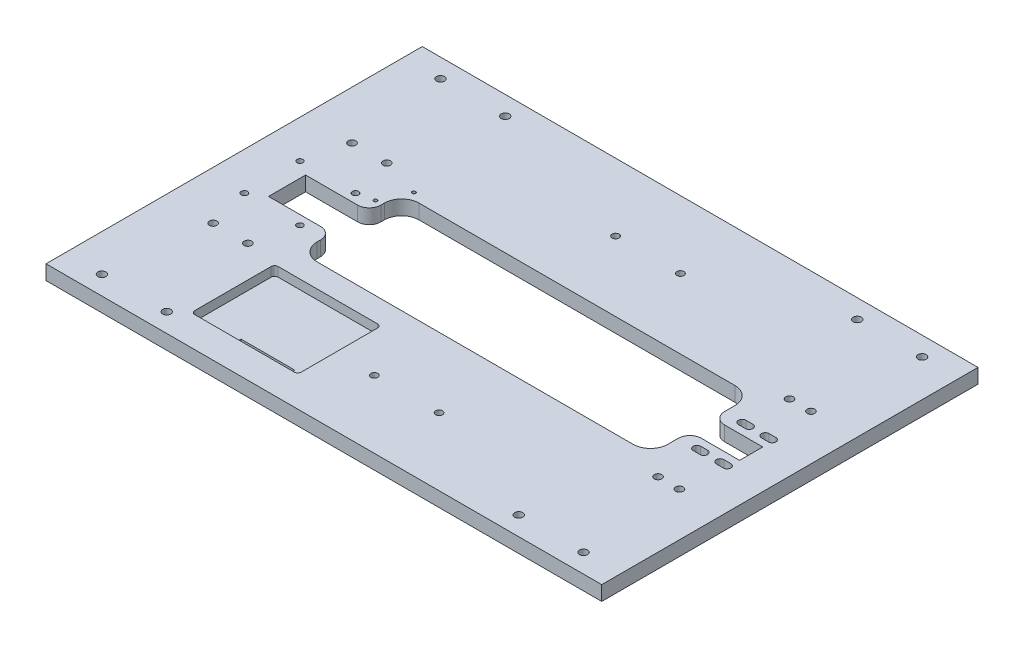
from build123d import *

# Parameters (mm, degrees)
SKETCH1_W                      = 480
SKETCH1_H                      = 325
BOSS_EXTRUDE1_DEPTH            = 12.6
CUT_EXTRUDE1_REACH             = 292.112
SKETCH2_R                      = 3
CUT_EXTRUDE2_REACH             = 292.112
FILLET1_R                      = 10
CUT_EXTRUDE3_REACH             = 292.112
SKETCH4_R                      = 2.618497629
SKETCH4_R_2                    = 2.7
SKETCH4_R_3                    = 2.5
SKETCH4_R_4                    = 3.25
FILLET2_R                      = 10
SKETCH5_R                      = 3.25
CUT_EXTRUDE4_DEPTH             = 2
CUT_EXTRUDE5_REACH             = 292.112
SKETCH5_2_R                    = 3.25
CUT_EXTRUDE6_REACH             = 292.112
CUT_EXTRUDE6_DIRECTION_2_DEPTH = 2
CUT_EXTRUDE7_REACH             = 292.112
SKETCH7_R                      = 2.25
SKETCH8_R                      = 3.5
CUT_EXTRUDE8_DEPTH             = 6
CUT_EXTRUDE9_DEPTH             = 8
CUT_EXTRUDE10_REACH            = 291.949
SKETCH10_W                     = 46.435426172
SKETCH10_H                     = 7
CUT_EXTRUDE11_REACH            = 292.112
SKETCH12_R                     = 1.5
FILLET3_R                      = 15


with BuildPart() as part:
    # Sketch1 → Boss-Extrude1 (new body)
    with BuildSketch(Plane(origin=(0, 0, 0), x_dir=(1, 0, 0), z_dir=(0, 1, 0))):
        Rectangle(SKETCH1_W, SKETCH1_H)
    extrude(amount=BOSS_EXTRUDE1_DEPTH)

    # Sketch2 → Cut-Extrude1 (cut, up to next)
    with BuildSketch(Plane.XZ, mode=Mode.PRIVATE) as cut_extrude1_sk1:
        with Locations((41.247428317, -104.2)):
            Circle(SKETCH2_R)
    cut_extrude1_tool1 = extrude(cut_extrude1_sk1.sketch, amount=-CUT_EXTRUDE1_REACH, mode=Mode.PRIVATE) & part.part
    # Sketch2 → Cut-Extrude1 (cut, up to next)
    with BuildSketch(Plane.XZ, mode=Mode.PRIVATE) as cut_extrude1_sk2:
        with Locations((-14.752571683, -104.2)):
            Circle(SKETCH2_R)
    cut_extrude1_tool2 = extrude(cut_extrude1_sk2.sketch, amount=-CUT_EXTRUDE1_REACH, mode=Mode.PRIVATE) & part.part
    # Sketch2 → Cut-Extrude1 (cut, up to next)
    with BuildSketch(Plane.XZ, mode=Mode.PRIVATE) as cut_extrude1_sk3:
        with Locations((41.247428317, 104.2)):
            Circle(SKETCH2_R)
    cut_extrude1_tool3 = extrude(cut_extrude1_sk3.sketch, amount=-CUT_EXTRUDE1_REACH, mode=Mode.PRIVATE) & part.part
    # Sketch2 → Cut-Extrude1 (cut, up to next)
    with BuildSketch(Plane.XZ, mode=Mode.PRIVATE) as cut_extrude1_sk4:
        with Locations((-14.752571683, 104.2)):
            Circle(SKETCH2_R)
    cut_extrude1_tool4 = extrude(cut_extrude1_sk4.sketch, amount=-CUT_EXTRUDE1_REACH, mode=Mode.PRIVATE) & part.part
    add(cut_extrude1_tool1.solids().sort_by_distance((41.247428, 0, -104.2))[0], mode=Mode.SUBTRACT)
    add(cut_extrude1_tool2.solids().sort_by_distance((-14.752572, 0, -104.2))[0], mode=Mode.SUBTRACT)
    add(cut_extrude1_tool3.solids().sort_by_distance((41.247428, 0, 104.2))[0], mode=Mode.SUBTRACT)
    add(cut_extrude1_tool4.solids().sort_by_distance((-14.752572, 0, 104.2))[0], mode=Mode.SUBTRACT)

    # Sketch3 → Cut-Extrude2 (cut, up to next)
    with BuildSketch(Plane.XZ, mode=Mode.PRIVATE) as cut_extrude2_sk1:
        Polygon((163.584746975, 44), (-139.288669968, 44), (-139.288669968, 16), (-194.288669968, 16), (-194.288669968, -16), (-139.288669968, -16), (-139.288669968, -44), (163.584746975, -44), (163.584746975, -10), (206.584746975, -10), (206.584746975, 10), (163.584746975, 10), align=None)
    cut_extrude2_tool1 = extrude(cut_extrude2_sk1.sketch, amount=-CUT_EXTRUDE2_REACH, mode=Mode.PRIVATE) & part.part
    add(cut_extrude2_tool1.solids().sort_by_distance((6.470321, 0, 0))[0], mode=Mode.SUBTRACT)

    # Fillet1
    fillet1_edges = [part.edges().sort_by_distance(p)[0] for p in [
        (-139.288669968, 6.3, 16),
        (-139.288669968, 6.3, -16),
    ]]
    fillet(fillet1_edges, radius=FILLET1_R)

    # Sketch4 → Cut-Extrude3 (cut, up to next)
    with BuildSketch(Plane.XZ, mode=Mode.PRIVATE) as cut_extrude3_sk1:
        with Locations((-159.175714853, 24)):
            Circle(SKETCH4_R)
    cut_extrude3_tool1 = extrude(cut_extrude3_sk1.sketch, amount=-CUT_EXTRUDE3_REACH, mode=Mode.PRIVATE) & part.part
    # Sketch4 → Cut-Extrude3 (cut, up to next)
    with BuildSketch(Plane.XZ, mode=Mode.PRIVATE) as cut_extrude3_sk2:
        with Locations((-207.175714853, 24)):
            Circle(SKETCH4_R_2)
    cut_extrude3_tool2 = extrude(cut_extrude3_sk2.sketch, amount=-CUT_EXTRUDE3_REACH, mode=Mode.PRIVATE) & part.part
    # Sketch4 → Cut-Extrude3 (cut, up to next)
    with BuildSketch(Plane.XZ, mode=Mode.PRIVATE) as cut_extrude3_sk3:
        with Locations((-207.175714853, -24)):
            Circle(SKETCH4_R_3)
    cut_extrude3_tool3 = extrude(cut_extrude3_sk3.sketch, amount=-CUT_EXTRUDE3_REACH, mode=Mode.PRIVATE) & part.part
    # Sketch4 → Cut-Extrude3 (cut, up to next)
    with BuildSketch(Plane.XZ, mode=Mode.PRIVATE) as cut_extrude3_sk4:
        with Locations((-159.175714853, -24)):
            Circle(SKETCH4_R_2)
    cut_extrude3_tool4 = extrude(cut_extrude3_sk4.sketch, amount=-CUT_EXTRUDE3_REACH, mode=Mode.PRIVATE) & part.part
    # Sketch4 → Cut-Extrude3 (cut, up to next)
    with BuildSketch(Plane.XZ, mode=Mode.PRIVATE) as cut_extrude3_sk5:
        with Locations((-168.175714853, -60.002723044)):
            Circle(SKETCH4_R_4)
    cut_extrude3_tool5 = extrude(cut_extrude3_sk5.sketch, amount=-CUT_EXTRUDE3_REACH, mode=Mode.PRIVATE) & part.part
    # Sketch4 → Cut-Extrude3 (cut, up to next)
    with BuildSketch(Plane.XZ, mode=Mode.PRIVATE) as cut_extrude3_sk6:
        with Locations((-198.175714853, -60.002723044)):
            Circle(SKETCH4_R_4)
    cut_extrude3_tool6 = extrude(cut_extrude3_sk6.sketch, amount=-CUT_EXTRUDE3_REACH, mode=Mode.PRIVATE) & part.part
    # Sketch4 → Cut-Extrude3 (cut, up to next)
    with BuildSketch(Plane.XZ, mode=Mode.PRIVATE) as cut_extrude3_sk7:
        with Locations((-168.175714853, 60)):
            Circle(SKETCH4_R_4)
    cut_extrude3_tool7 = extrude(cut_extrude3_sk7.sketch, amount=-CUT_EXTRUDE3_REACH, mode=Mode.PRIVATE) & part.part
    # Sketch4 → Cut-Extrude3 (cut, up to next)
    with BuildSketch(Plane.XZ, mode=Mode.PRIVATE) as cut_extrude3_sk8:
        with Locations((-198.175714853, 60)):
            Circle(SKETCH4_R_4)
    cut_extrude3_tool8 = extrude(cut_extrude3_sk8.sketch, amount=-CUT_EXTRUDE3_REACH, mode=Mode.PRIVATE) & part.part
    add(cut_extrude3_tool1.solids().sort_by_distance((-159.175715, 0, 24))[0], mode=Mode.SUBTRACT)
    add(cut_extrude3_tool2.solids().sort_by_distance((-207.175715, 0, 24))[0], mode=Mode.SUBTRACT)
    add(cut_extrude3_tool3.solids().sort_by_distance((-207.175715, 0, -24))[0], mode=Mode.SUBTRACT)
    add(cut_extrude3_tool4.solids().sort_by_distance((-159.175715, 0, -24))[0], mode=Mode.SUBTRACT)
    add(cut_extrude3_tool5.solids().sort_by_distance((-168.175715, 0, -60.002723))[0], mode=Mode.SUBTRACT)
    add(cut_extrude3_tool6.solids().sort_by_distance((-198.175715, 0, -60.002723))[0], mode=Mode.SUBTRACT)
    add(cut_extrude3_tool7.solids().sort_by_distance((-168.175715, 0, 60))[0], mode=Mode.SUBTRACT)
    add(cut_extrude3_tool8.solids().sort_by_distance((-198.175715, 0, 60))[0], mode=Mode.SUBTRACT)

    # Fillet2
    fillet2_edges = [part.edges().sort_by_distance(p)[0] for p in [
        (163.584746975, 6.3, -10),
        (163.584746975, 6.3, 10),
    ]]
    fillet(fillet2_edges, radius=FILLET2_R)

    # Sketch5 → Cut-Extrude4 (cut)
    with BuildSketch(Plane.XZ):
        with Locations((183.62480094, 57.5)):
            Circle(SKETCH5_R)
        with Locations((202.135280509, 57.5)):
            Circle(SKETCH5_R)
        with Locations((200.716342035, -57.5)):
            Circle(SKETCH5_R)
        with Locations((182.205862466, -57.5)):
            Circle(SKETCH5_R)
    extrude(amount=-CUT_EXTRUDE4_DEPTH, mode=Mode.SUBTRACT)

    # Sketch5<2> → Cut-Extrude5 (cut, up to next)
    with BuildSketch(Plane.XZ, mode=Mode.PRIVATE) as cut_extrude5_sk1:
        with Locations((183.62480094, 57.5)):
            Circle(SKETCH5_2_R)
    cut_extrude5_tool1 = extrude(cut_extrude5_sk1.sketch, amount=-CUT_EXTRUDE5_REACH, mode=Mode.PRIVATE) & part.part
    # Sketch5<2> → Cut-Extrude5 (cut, up to next)
    with BuildSketch(Plane.XZ, mode=Mode.PRIVATE) as cut_extrude5_sk2:
        with Locations((202.135280509, 57.5)):
            Circle(SKETCH5_2_R)
    cut_extrude5_tool2 = extrude(cut_extrude5_sk2.sketch, amount=-CUT_EXTRUDE5_REACH, mode=Mode.PRIVATE) & part.part
    # Sketch5<2> → Cut-Extrude5 (cut, up to next)
    with BuildSketch(Plane.XZ, mode=Mode.PRIVATE) as cut_extrude5_sk3:
        with Locations((200.716342035, -57.5)):
            Circle(SKETCH5_2_R)
    cut_extrude5_tool3 = extrude(cut_extrude5_sk3.sketch, amount=-CUT_EXTRUDE5_REACH, mode=Mode.PRIVATE) & part.part
    # Sketch5<2> → Cut-Extrude5 (cut, up to next)
    with BuildSketch(Plane.XZ, mode=Mode.PRIVATE) as cut_extrude5_sk4:
        with Locations((182.205862466, -57.5)):
            Circle(SKETCH5_2_R)
    cut_extrude5_tool4 = extrude(cut_extrude5_sk4.sketch, amount=-CUT_EXTRUDE5_REACH, mode=Mode.PRIVATE) & part.part
    add(cut_extrude5_tool1.solids().sort_by_distance((183.624801, 0, 57.5))[0], mode=Mode.SUBTRACT)
    add(cut_extrude5_tool2.solids().sort_by_distance((202.135281, 0, 57.5))[0], mode=Mode.SUBTRACT)
    add(cut_extrude5_tool3.solids().sort_by_distance((200.716342, 0, -57.5))[0], mode=Mode.SUBTRACT)
    add(cut_extrude5_tool4.solids().sort_by_distance((182.205862, 0, -57.5))[0], mode=Mode.SUBTRACT)

    # Sketch6 → Cut-Extrude6 (cut, up to next)
    with BuildSketch(Plane.XZ, mode=Mode.PRIVATE) as cut_extrude6_sk1:
        with BuildLine():
            Line((205.261171344, -22.75), (199.261171344, -22.75))
            ThreePointArc((199.261171344, -22.75), (196.011171344, -19.5), (199.261171344, -16.25))
            Line((199.261171344, -16.25), (205.261171344, -16.25))
            ThreePointArc((205.261171344, -16.25), (208.511171344, -19.5), (205.261171344, -22.75))
        make_face()
    cut_extrude6_tool1 = extrude(cut_extrude6_sk1.sketch, amount=-CUT_EXTRUDE6_REACH, mode=Mode.PRIVATE) & part.part
    # Sketch6 → Cut-Extrude6 (cut, up to next)
    with BuildSketch(Plane.XZ, mode=Mode.PRIVATE) as cut_extrude6_sk2:
        with BuildLine():
            Line((185.261171344, -22.75), (179.261171344, -22.75))
            ThreePointArc((179.261171344, -22.75), (176.011171344, -19.5), (179.261171344, -16.25))
            Line((179.261171344, -16.25), (185.261171344, -16.25))
            ThreePointArc((185.261171344, -16.25), (188.511171344, -19.5), (185.261171344, -22.75))
        make_face()
    cut_extrude6_tool2 = extrude(cut_extrude6_sk2.sketch, amount=-CUT_EXTRUDE6_REACH, mode=Mode.PRIVATE) & part.part
    # Sketch6 → Cut-Extrude6 (cut, up to next)
    with BuildSketch(Plane.XZ, mode=Mode.PRIVATE) as cut_extrude6_sk3:
        with BuildLine():
            Line((205.261171344, 16.25), (199.261171344, 16.25))
            ThreePointArc((199.261171344, 16.25), (196.011171344, 19.5), (199.261171344, 22.75))
            Line((199.261171344, 22.75), (205.261171344, 22.75))
            ThreePointArc((205.261171344, 22.75), (208.511171344, 19.5), (205.261171344, 16.25))
        make_face()
    cut_extrude6_tool3 = extrude(cut_extrude6_sk3.sketch, amount=-CUT_EXTRUDE6_REACH, mode=Mode.PRIVATE) & part.part
    # Sketch6 → Cut-Extrude6 (cut, up to next)
    with BuildSketch(Plane.XZ, mode=Mode.PRIVATE) as cut_extrude6_sk4:
        with BuildLine():
            Line((185.261171344, 16.25), (179.261171344, 16.25))
            ThreePointArc((179.261171344, 16.25), (176.011171344, 19.5), (179.261171344, 22.75))
            Line((179.261171344, 22.75), (185.261171344, 22.75))
            ThreePointArc((185.261171344, 22.75), (188.511171344, 19.5), (185.261171344, 16.25))
        make_face()
    cut_extrude6_tool4 = extrude(cut_extrude6_sk4.sketch, amount=-CUT_EXTRUDE6_REACH, mode=Mode.PRIVATE) & part.part
    add(cut_extrude6_tool1.solids().sort_by_distance((202.261171, 0, -19.5))[0], mode=Mode.SUBTRACT)
    add(cut_extrude6_tool2.solids().sort_by_distance((182.261171, 0, -19.5))[0], mode=Mode.SUBTRACT)
    add(cut_extrude6_tool3.solids().sort_by_distance((202.261171, 0, 19.5))[0], mode=Mode.SUBTRACT)
    add(cut_extrude6_tool4.solids().sort_by_distance((182.261171, 0, 19.5))[0], mode=Mode.SUBTRACT)

    # Sketch6 → Cut-Extrude6 direction 2 (cut)
    with BuildSketch(Plane.XZ):
        with BuildLine():
            Line((205.261171344, -22.75), (199.261171344, -22.75))
            ThreePointArc((199.261171344, -22.75), (196.011171344, -19.5), (199.261171344, -16.25))
            Line((199.261171344, -16.25), (205.261171344, -16.25))
            ThreePointArc((205.261171344, -16.25), (208.511171344, -19.5), (205.261171344, -22.75))
        make_face()
        with BuildLine():
            Line((185.261171344, -22.75), (179.261171344, -22.75))
            ThreePointArc((179.261171344, -22.75), (176.011171344, -19.5), (179.261171344, -16.25))
            Line((179.261171344, -16.25), (185.261171344, -16.25))
            ThreePointArc((185.261171344, -16.25), (188.511171344, -19.5), (185.261171344, -22.75))
        make_face()
        with BuildLine():
            Line((205.261171344, 16.25), (199.261171344, 16.25))
            ThreePointArc((199.261171344, 16.25), (196.011171344, 19.5), (199.261171344, 22.75))
            Line((199.261171344, 22.75), (205.261171344, 22.75))
            ThreePointArc((205.261171344, 22.75), (208.511171344, 19.5), (205.261171344, 16.25))
        make_face()
        with BuildLine():
            Line((185.261171344, 16.25), (179.261171344, 16.25))
            ThreePointArc((179.261171344, 16.25), (176.011171344, 19.5), (179.261171344, 22.75))
            Line((179.261171344, 22.75), (185.261171344, 22.75))
            ThreePointArc((185.261171344, 22.75), (188.511171344, 19.5), (185.261171344, 16.25))
        make_face()
    extrude(amount=CUT_EXTRUDE6_DIRECTION_2_DEPTH, mode=Mode.SUBTRACT)

    # Sketch7 → Cut-Extrude7 (cut, up to next)
    with BuildSketch(Plane(origin=(0, 12.6, 0), x_dir=(1, 0, 0), z_dir=(0, 1, 0)), mode=Mode.PRIVATE) as cut_extrude7_sk1:
        with Locations((208, -146.2)):
            Circle(SKETCH7_R)
    cut_extrude7_tool1 = extrude(cut_extrude7_sk1.sketch, amount=-CUT_EXTRUDE7_REACH, mode=Mode.PRIVATE) & part.part
    # Sketch7 → Cut-Extrude7 (cut, up to next)
    with BuildSketch(Plane(origin=(0, 12.6, 0), x_dir=(1, 0, 0), z_dir=(0, 1, 0)), mode=Mode.PRIVATE) as cut_extrude7_sk2:
        with Locations((152, -146.2)):
            Circle(SKETCH7_R)
    cut_extrude7_tool2 = extrude(cut_extrude7_sk2.sketch, amount=-CUT_EXTRUDE7_REACH, mode=Mode.PRIVATE) & part.part
    # Sketch7 → Cut-Extrude7 (cut, up to next)
    with BuildSketch(Plane(origin=(0, 12.6, 0), x_dir=(1, 0, 0), z_dir=(0, 1, 0)), mode=Mode.PRIVATE) as cut_extrude7_sk3:
        with Locations((-152, -146.2)):
            Circle(SKETCH7_R)
    cut_extrude7_tool3 = extrude(cut_extrude7_sk3.sketch, amount=-CUT_EXTRUDE7_REACH, mode=Mode.PRIVATE) & part.part
    # Sketch7 → Cut-Extrude7 (cut, up to next)
    with BuildSketch(Plane(origin=(0, 12.6, 0), x_dir=(1, 0, 0), z_dir=(0, 1, 0)), mode=Mode.PRIVATE) as cut_extrude7_sk4:
        with Locations((-208, -146.2)):
            Circle(SKETCH7_R)
    cut_extrude7_tool4 = extrude(cut_extrude7_sk4.sketch, amount=-CUT_EXTRUDE7_REACH, mode=Mode.PRIVATE) & part.part
    # Sketch7 → Cut-Extrude7 (cut, up to next)
    with BuildSketch(Plane(origin=(0, 12.6, 0), x_dir=(1, 0, 0), z_dir=(0, 1, 0)), mode=Mode.PRIVATE) as cut_extrude7_sk5:
        with Locations((-208, 146.2)):
            Circle(SKETCH7_R)
    cut_extrude7_tool5 = extrude(cut_extrude7_sk5.sketch, amount=-CUT_EXTRUDE7_REACH, mode=Mode.PRIVATE) & part.part
    # Sketch7 → Cut-Extrude7 (cut, up to next)
    with BuildSketch(Plane(origin=(0, 12.6, 0), x_dir=(1, 0, 0), z_dir=(0, 1, 0)), mode=Mode.PRIVATE) as cut_extrude7_sk6:
        with Locations((-152, 146.2)):
            Circle(SKETCH7_R)
    cut_extrude7_tool6 = extrude(cut_extrude7_sk6.sketch, amount=-CUT_EXTRUDE7_REACH, mode=Mode.PRIVATE) & part.part
    # Sketch7 → Cut-Extrude7 (cut, up to next)
    with BuildSketch(Plane(origin=(0, 12.6, 0), x_dir=(1, 0, 0), z_dir=(0, 1, 0)), mode=Mode.PRIVATE) as cut_extrude7_sk7:
        with Locations((208, 146.2)):
            Circle(SKETCH7_R)
    cut_extrude7_tool7 = extrude(cut_extrude7_sk7.sketch, amount=-CUT_EXTRUDE7_REACH, mode=Mode.PRIVATE) & part.part
    # Sketch7 → Cut-Extrude7 (cut, up to next)
    with BuildSketch(Plane(origin=(0, 12.6, 0), x_dir=(1, 0, 0), z_dir=(0, 1, 0)), mode=Mode.PRIVATE) as cut_extrude7_sk8:
        with Locations((152, 146.2)):
            Circle(SKETCH7_R)
    cut_extrude7_tool8 = extrude(cut_extrude7_sk8.sketch, amount=-CUT_EXTRUDE7_REACH, mode=Mode.PRIVATE) & part.part
    add(cut_extrude7_tool1.solids().sort_by_distance((208, 12.6, 146.2))[0], mode=Mode.SUBTRACT)
    add(cut_extrude7_tool2.solids().sort_by_distance((152, 12.6, 146.2))[0], mode=Mode.SUBTRACT)
    add(cut_extrude7_tool3.solids().sort_by_distance((-152, 12.6, 146.2))[0], mode=Mode.SUBTRACT)
    add(cut_extrude7_tool4.solids().sort_by_distance((-208, 12.6, 146.2))[0], mode=Mode.SUBTRACT)
    add(cut_extrude7_tool5.solids().sort_by_distance((-208, 12.6, -146.2))[0], mode=Mode.SUBTRACT)
    add(cut_extrude7_tool6.solids().sort_by_distance((-152, 12.6, -146.2))[0], mode=Mode.SUBTRACT)
    add(cut_extrude7_tool7.solids().sort_by_distance((208, 12.6, -146.2))[0], mode=Mode.SUBTRACT)
    add(cut_extrude7_tool8.solids().sort_by_distance((152, 12.6, -146.2))[0], mode=Mode.SUBTRACT)

    # Sketch8 → Cut-Extrude8 (cut)
    with BuildSketch(Plane(origin=(0, 12.6, 0), x_dir=(1, 0, 0), z_dir=(0, 1, 0))):
        with Locations((208, 146.2)):
            Circle(SKETCH8_R)
        with Locations((152, 146.2)):
            Circle(SKETCH8_R)
        with Locations((-152, 146.2)):
            Circle(SKETCH8_R)
        with Locations((-208, 146.2)):
            Circle(SKETCH8_R)
        with Locations((208, -146.2)):
            Circle(SKETCH8_R)
        with Locations((152, -146.2)):
            Circle(SKETCH8_R)
        with Locations((-208, -146.2)):
            Circle(SKETCH8_R)
        with Locations((-152, -146.2)):
            Circle(SKETCH8_R)
    extrude(amount=-CUT_EXTRUDE8_DEPTH, mode=Mode.SUBTRACT)

    # Sketch9 → Cut-Extrude9 (cut)
    with BuildSketch(Plane(origin=(0, 12.6, 0), x_dir=(1, 0, 0), z_dir=(0, 1, 0))):
        with BuildLine():
            Line((-137.738585948, -64.277994944), (-51.738585948, -64.277994944))
            ThreePointArc((-51.738585948, -64.277994944), (-49.617265604, -65.156674601), (-48.738585948, -67.277994944))
            Line((-48.738585948, -67.277994944), (-48.738585948, -133.277994944))
            ThreePointArc((-48.738585948, -133.277994944), (-49.617265604, -135.399315288), (-51.738585948, -136.277994944))
            Line((-51.738585948, -136.277994944), (-137.738585948, -136.277994944))
            ThreePointArc((-137.738585948, -136.277994944), (-139.859906291, -135.399315288), (-140.738585948, -133.277994944))
            Line((-140.738585948, -133.277994944), (-140.738585948, -67.277994944))
            ThreePointArc((-140.738585948, -67.277994944), (-139.859906291, -65.156674601), (-137.738585948, -64.277994944))
        make_face()
    extrude(amount=-CUT_EXTRUDE9_DEPTH, mode=Mode.SUBTRACT)

    # Sketch10 → Cut-Extrude10 (cut, up to next)
    with BuildSketch(Plane(origin=(0, 4.6, 0), x_dir=(1, 0, 0), z_dir=(0, 1, 0)), mode=Mode.PRIVATE) as cut_extrude10_sk1:
        with Locations((-84.166449654, -130.120684117)):
            Rectangle(SKETCH10_W, SKETCH10_H)
    cut_extrude10_tool1 = extrude(cut_extrude10_sk1.sketch, amount=-CUT_EXTRUDE10_REACH, mode=Mode.PRIVATE) & part.part
    add(cut_extrude10_tool1.solids().sort_by_distance((-84.16645, 4.6, 130.120684))[0], mode=Mode.SUBTRACT)

    # Sketch12 → Cut-Extrude11 (cut, up to next)
    with BuildSketch(Plane.XZ, mode=Mode.PRIVATE) as cut_extrude11_sk1:
        with Locations((-145.098644241, -27.142001554)):
            Circle(SKETCH12_R)
    cut_extrude11_tool1 = extrude(cut_extrude11_sk1.sketch, amount=-CUT_EXTRUDE11_REACH, mode=Mode.PRIVATE) & part.part
    # Sketch12 → Cut-Extrude11 (cut, up to next)
    with BuildSketch(Plane.XZ, mode=Mode.PRIVATE) as cut_extrude11_sk2:
        with Locations((-134.498644241, -49.742001554)):
            Circle(SKETCH12_R)
    cut_extrude11_tool2 = extrude(cut_extrude11_sk2.sketch, amount=-CUT_EXTRUDE11_REACH, mode=Mode.PRIVATE) & part.part
    add(cut_extrude11_tool1.solids().sort_by_distance((-145.098644, 0, -27.142002))[0], mode=Mode.SUBTRACT)
    add(cut_extrude11_tool2.solids().sort_by_distance((-134.498644, 0, -49.742002))[0], mode=Mode.SUBTRACT)

    # Fillet3
    fillet3_edges = [part.edges().sort_by_distance(p)[0] for p in [
        (163.584746975, 6.3, 44),
        (163.584746975, 6.3, -44),
        (-139.288669968, 6.3, 44),
        (-139.288669968, 6.3, -44),
    ]]
    fillet(fillet3_edges, radius=FILLET3_R)


solid = part.part
